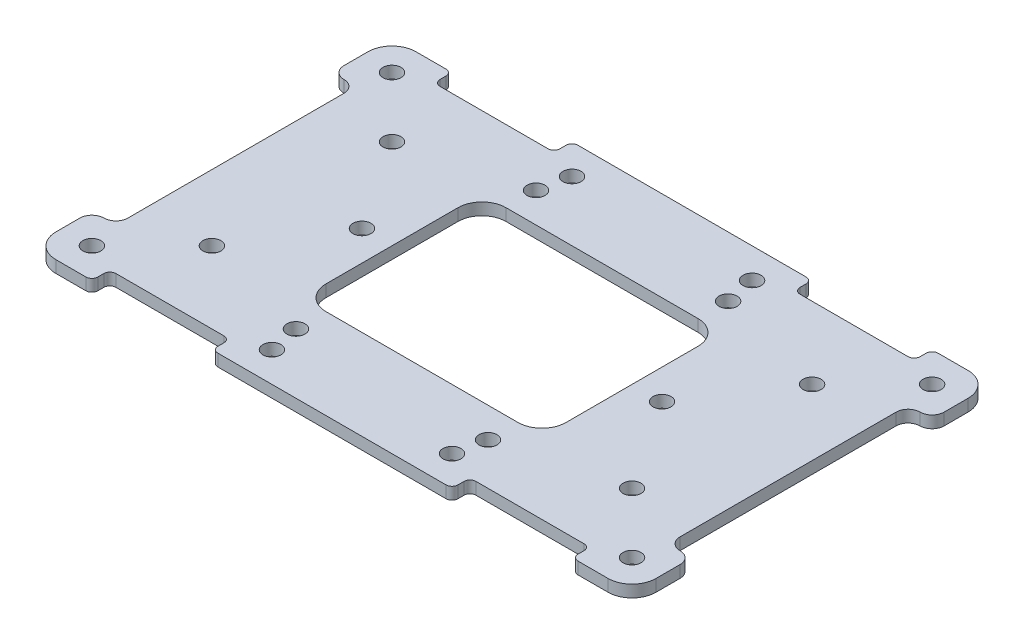
from build123d import *

# Parameters (mm, degrees)
SKETCH_1_W           = 100
SKETCH_1_H           = 60
EXTRUDE_1_DEPTH      = 2
SKETCH_4_W           = 40
SKETCH_4_H           = 30
CUT_EXTRUDE_3_DEPTH  = 59.343808583
SKETCH_6_R           = 1.5
CUT_EXTRUDE_5_DEPTH  = 59.343808583
SKETCH_7_W           = 20
SKETCH_7_H           = 3
CUT_EXTRUDE_6_DEPTH  = 59.343808583
FILLET_1_R           = 4
FILLET_2_R           = 1
SKETCH_8_R           = 1.5
CUT_EXTRUDE_7_DEPTH  = 59.343808583
SKETCH_9_W           = 4
SKETCH_9_H           = 40
CUT_EXTRUDE_9_DEPTH  = 59.343808583
FILLET_START         = -1
FILLET_3_DEPTH       = 4
FILLET_3_2_DEPTH     = 2
SKETCH_10_R          = 1.5
CUT_EXTRUDE_10_DEPTH = 59.343808583


with BuildPart() as part:
    # 草图1 → 凸台-拉伸1 (new body)
    with BuildSketch(Plane(origin=(0, 0, 0), x_dir=(1, 0, 0), z_dir=(0, 1, 0))):
        Rectangle(SKETCH_1_W, SKETCH_1_H)
    extrude(amount=EXTRUDE_1_DEPTH)

    # 草图4 → 切除-拉伸3 (cut, through all)
    with BuildSketch(Plane(origin=(0, 2, 0), x_dir=(1, 0, 0), z_dir=(0, 1, 0))):
        Rectangle(SKETCH_4_W, SKETCH_4_H)
    extrude(amount=-CUT_EXTRUDE_3_DEPTH, mode=Mode.SUBTRACT)

    # 草图6 → 切除-拉伸5 (cut, through all)
    with BuildSketch(Plane(origin=(0, 2, 0), x_dir=(1, 0, 0), z_dir=(0, 1, 0))):
        with Locations(Location((-45, 25, 0), (0, 0, 270))):
            Circle(SKETCH_6_R)
        with Locations(Location((-45, -25, 0), (0, 0, 90))):
            Circle(SKETCH_6_R)
        with Locations(Location((45, -25, 0), (0, 0, 270))):
            Circle(SKETCH_6_R)
        with Locations(Location((45, 25, 0), (0, 0, 90))):
            Circle(SKETCH_6_R)
    extrude(amount=-CUT_EXTRUDE_5_DEPTH, mode=Mode.SUBTRACT)

    # 草图7 → 切除-拉伸6 (cut, through all)
    with BuildSketch(Plane(origin=(0, 2, 0), x_dir=(1, 0, 0), z_dir=(0, 1, 0))):
        with Locations((-30, 28.5)):
            Rectangle(SKETCH_7_W, SKETCH_7_H)
        with Locations((-30, -28.5)):
            Rectangle(SKETCH_7_W, SKETCH_7_H)
        with Locations((30, -28.5)):
            Rectangle(SKETCH_7_W, SKETCH_7_H)
        with Locations((30, 28.5)):
            Rectangle(SKETCH_7_W, SKETCH_7_H)
    extrude(amount=-CUT_EXTRUDE_6_DEPTH, mode=Mode.SUBTRACT)

    # 圆角1
    fillet_1_edges = [part.edges().sort_by_distance(p)[0] for p in [
        (20, 1, -15),
        (20, 1, 15),
        (-20, 1, 15),
        (-20, 1, -15),
        (50, 1, 30),
        (-50, 1, 30),
        (-50, 1, -30),
        (50, 1, -30),
    ]]
    fillet(fillet_1_edges, radius=FILLET_1_R)

    # 圆角2
    fillet_2_edges = [part.edges().sort_by_distance(p)[0] for p in [
        (40, 1, -30),
        (40, 1, -27),
        (20, 1, -27),
        (20, 1, -30),
        (40, 1, 30),
        (20, 1, 30),
        (20, 1, 27),
        (40, 1, 27),
        (-40, 1, 30),
        (-40, 1, 27),
        (-20, 1, 27),
        (-20, 1, 30),
        (-40, 1, -27),
        (-40, 1, -30),
        (-20, 1, -30),
        (-20, 1, -27),
    ]]
    fillet(fillet_2_edges, radius=FILLET_2_R)

    # 草图8 → 切除-拉伸7 (cut, through all)
    with BuildSketch(Plane(origin=(0, 2, 0), x_dir=(1, 0, 0), z_dir=(0, 1, 0))):
        with Locations(Location((-15, 25, 0), (0, 0, 270))):
            Circle(SKETCH_8_R)
        with Locations(Location((-15, -25, 0), (0, 0, 90))):
            Circle(SKETCH_8_R)
        with Locations(Location((15, -25, 0), (0, 0, 270))):
            Circle(SKETCH_8_R)
        with Locations(Location((15, 25, 0), (0, 0, 90))):
            Circle(SKETCH_8_R)
    extrude(amount=-CUT_EXTRUDE_7_DEPTH, mode=Mode.SUBTRACT)

    # 草图9 → 切除-拉伸9 (cut, through all)
    with BuildSketch(Plane(origin=(0, 2, 0), x_dir=(1, 0, 0), z_dir=(0, 1, 0))):
        with Locations((-48, 0)):
            Rectangle(SKETCH_9_W, SKETCH_9_H)
        with Locations((48, 0)):
            Rectangle(SKETCH_9_W, SKETCH_9_H)
    extrude(amount=-CUT_EXTRUDE_9_DEPTH, mode=Mode.SUBTRACT)

    # 圆角3: read off the stored shape, not the designer's step
    # 圆角3 outline → 圆角3 (cut)
    with BuildSketch(Plane(origin=(0, 0, 0), x_dir=(1, 0, 0), z_dir=(0, 1, 0)).offset(FILLET_START)):
        with BuildLine():
            Line((50, -20), (48, -20))
            ThreePointArc((48, -20), (49.414213562, -20.585786438), (50, -22))
            Line((50, -22), (50, -20))
        make_face()
        with BuildLine():
            ThreePointArc((50, 22), (49.414213562, 20.585786438), (48, 20))
            Line((48, 20), (50, 20))
            Line((50, 20), (50, 22))
        make_face()
        with BuildLine():
            Line((-50, 20), (-48, 20))
            ThreePointArc((-48, 20), (-49.414213562, 20.585786438), (-50, 22))
            Line((-50, 22), (-50, 20))
        make_face()
        with BuildLine():
            ThreePointArc((-50, -22), (-49.414213562, -20.585786438), (-48, -20))
            Line((-48, -20), (-50, -20))
            Line((-50, -20), (-50, -22))
        make_face()
    extrude(amount=FILLET_3_DEPTH, mode=Mode.SUBTRACT)

    # Fillet 3 2 outline → Fillet 3 2 (add)
    with BuildSketch(Plane(origin=(0, 0, 0), x_dir=(1, 0, 0), z_dir=(0, 1, 0))):
        with BuildLine():
            Line((46, -20), (48, -20))
            ThreePointArc((48, -20), (46.585786438, -19.414213562), (46, -18))
            Line((46, -18), (46, -20))
        make_face()
        with BuildLine():
            Line((46, 20), (46, 18))
            ThreePointArc((46, 18), (46.585786438, 19.414213562), (48, 20))
            Line((48, 20), (46, 20))
        make_face()
        with BuildLine():
            ThreePointArc((-48, 20), (-46.585786438, 19.414213562), (-46, 18))
            Line((-46, 18), (-46, 20))
            Line((-46, 20), (-48, 20))
        make_face()
        with BuildLine():
            ThreePointArc((-46, -18), (-46.585786438, -19.414213562), (-48, -20))
            Line((-48, -20), (-46, -20))
            Line((-46, -20), (-46, -18))
        make_face()
    extrude(amount=FILLET_3_2_DEPTH)

    # 草图10 → 切除-拉伸10 (cut, through all)
    with BuildSketch(Plane(origin=(0, 2, 0), x_dir=(1, 0, 0), z_dir=(0, 1, 0))):
        with Locations(Location((-25, 0, 0), (0, 0, 270))):
            Circle(SKETCH_10_R)
        with Locations(Location((-16, 20, 0), (0, 0, 270))):
            Circle(SKETCH_10_R)
        with Locations(Location((-16, -20, 0), (0, 0, 90))):
            Circle(SKETCH_10_R)
        with Locations(Location((16, 20, 0), (0, 0, 90))):
            Circle(SKETCH_10_R)
        with Locations(Location((16, -20, 0), (0, 0, 270))):
            Circle(SKETCH_10_R)
        with Locations(Location((25, 0, 0), (0, 0, 90))):
            Circle(SKETCH_10_R)
        with Locations(Location((-35, 15, 0), (0, 0, 270))):
            Circle(SKETCH_10_R)
        with Locations(Location((-35, -15, 0), (0, 0, 90))):
            Circle(SKETCH_10_R)
        with Locations(Location((35, -15, 0), (0, 0, 270))):
            Circle(SKETCH_10_R)
        with Locations(Location((35, 15, 0), (0, 0, 90))):
            Circle(SKETCH_10_R)
    extrude(amount=-CUT_EXTRUDE_10_DEPTH, mode=Mode.SUBTRACT)


solid = part.part
